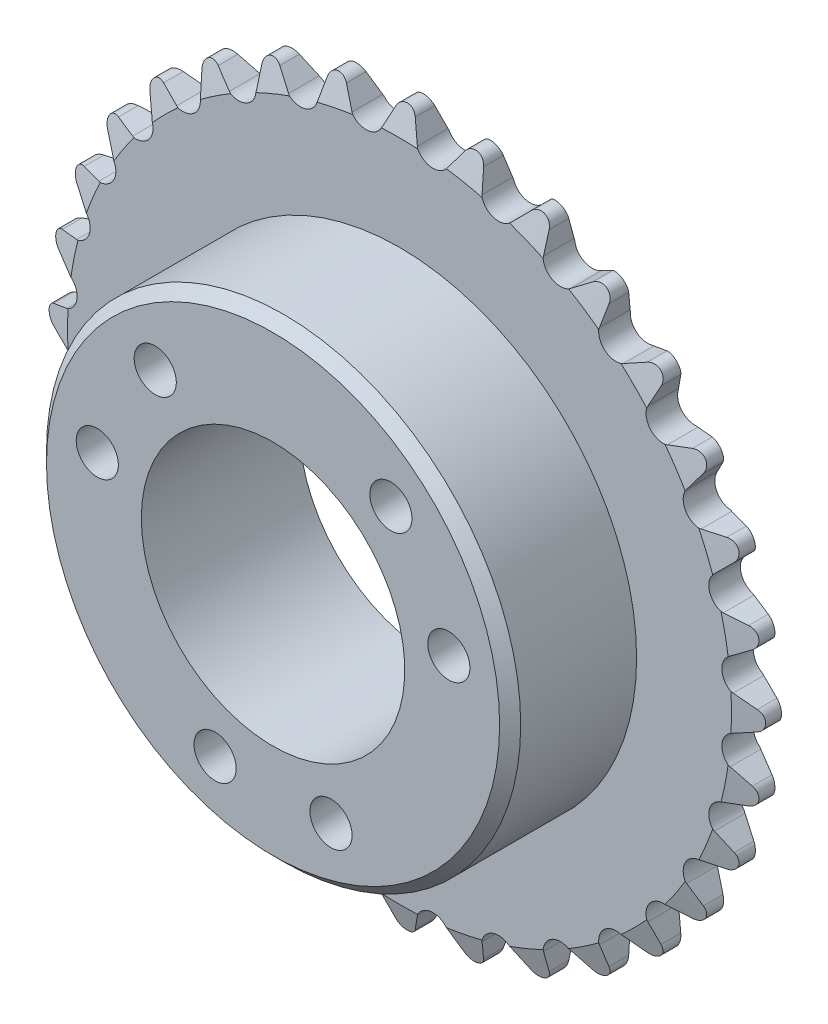
from build123d import *

# Parameters (mm, degrees)
BOSS_EXTRUDE1_DEPTH = 3
SKETCH3_R           = 22.5
BOSS_EXTRUDE2_DEPTH = 15
SKETCH4_R           = 12.5
CUT_EXTRUDE1_DEPTH  = 15
SKETCH5_R           = 2
CUT_EXTRUDE2_DEPTH  = 15


with BuildPart() as part:
    # Sketch1 → Boss-Extrude1 (new body)
    with BuildSketch(Plane.XY):
        with BuildLine():
            Line((0.925654891, 33.378368897), (1.647669429, 31.612007301))
            ThreePointArc((1.647669429, 31.612007301), (2.18900723, 30.913320041), (3.013271718, 30.594261182))
            ThreePointArc((3.013271718, 30.594261182), (3.883943491, 30.74638339), (4.551186761, 31.326035804))
            Line((4.551186761, 31.326035804), (5.603928044, 32.917599209))
            ThreePointArc((5.603928044, 32.917599209), (6.633070949, 33.346699534), (7.419665429, 32.556426587))
            Line((7.419665429, 32.556426587), (7.783206607, 30.683147085))
            ThreePointArc((7.783206607, 30.683147085), (8.177835631, 29.892275139), (8.924016813, 29.418540882))
            ThreePointArc((8.924016813, 29.418540882), (9.807636442, 29.397880468), (10.575143396, 29.836222319))
            Line((10.575143396, 29.836222319), (11.918155168, 31.191824644))
            ThreePointArc((11.918155168, 31.191824644), (13.0112367, 31.411904105), (13.628542384, 30.483359062))
            Line((13.628542384, 30.483359062), (13.61963952, 28.575150734))
            ThreePointArc((13.61963952, 28.575150734), (13.852394395, 27.722486867), (14.491816946, 27.112282554))
            ThreePointArc((14.491816946, 27.112282554), (15.354427425, 26.919633486), (16.192703201, 27.199819543))
            Line((16.192703201, 27.199819543), (17.774374272, 28.26736575))
            ThreePointArc((17.774374272, 28.26736575), (18.889387923, 28.269966818), (19.313682099, 27.238833142))
            Line((19.313682099, 27.238833142), (18.932677324, 25.369027366))
            ThreePointArc((18.932677324, 25.369027366), (18.994613411, 24.487338972), (19.502704681, 23.764114413))
            ThreePointArc((19.502704681, 23.764114413), (20.311156373, 23.406880086), (21.187986503, 23.518142956))
            Line((21.187986503, 23.518142956), (22.947534141, 24.256607843))
            ThreePointArc((22.947534141, 24.256607843), (24.04163056, 24.04163056), (24.256607843, 22.947534141))
            Line((24.256607843, 22.947534141), (23.518142956, 21.187986503))
            ThreePointArc((23.518142956, 21.187986503), (23.406880086, 20.311156373), (23.764114413, 19.502704681))
            ThreePointArc((23.764114413, 19.502704681), (24.487338972, 18.994613411), (25.369027366, 18.932677324))
            Line((25.369027366, 18.932677324), (27.238833142, 19.3136821))
            ThreePointArc((27.238833142, 19.3136821), (28.269966818, 18.889387923), (28.26736575, 17.774374272))
            Line((28.26736575, 17.774374272), (27.199819543, 16.192703201))
            ThreePointArc((27.199819543, 16.192703201), (26.919633486, 15.354427425), (27.112282554, 14.491816946))
            ThreePointArc((27.112282554, 14.491816946), (27.722486867, 13.852394395), (28.575150734, 13.61963952))
            Line((28.575150734, 13.61963952), (30.483359061, 13.628542385))
            ThreePointArc((30.483359061, 13.628542385), (31.411904105, 13.0112367), (31.191824643, 11.918155168))
            Line((31.191824643, 11.918155168), (29.836222319, 10.575143396))
            ThreePointArc((29.836222319, 10.575143396), (29.397880468, 9.807636443), (29.418540882, 8.924016813))
            ThreePointArc((29.418540882, 8.924016813), (29.892275139, 8.177835631), (30.683147085, 7.783206607))
            Line((30.683147085, 7.783206607), (32.556426587, 7.419665429))
            ThreePointArc((32.556426587, 7.419665429), (33.346699534, 6.633070949), (32.917599209, 5.603928044))
            Line((32.917599209, 5.603928044), (31.326035804, 4.551186761))
            ThreePointArc((31.326035804, 4.551186761), (30.74638339, 3.883943491), (30.594261182, 3.013271719))
            ThreePointArc((30.594261182, 3.013271719), (30.91332004, 2.18900723), (31.612007301, 1.647669429))
            Line((31.612007301, 1.647669429), (33.378368897, 0.925654891))
            ThreePointArc((33.378368897, 0.925654891), (34, 0), (33.378368897, -0.925654891))
            Line((33.378368897, -0.925654891), (31.612007301, -1.647669429))
            ThreePointArc((31.612007301, -1.647669429), (30.913320041, -2.18900723), (30.594261182, -3.013271718))
            ThreePointArc((30.594261182, -3.013271718), (30.74638339, -3.883943491), (31.326035804, -4.551186761))
            Line((31.326035804, -4.551186761), (32.917599209, -5.603928044))
            ThreePointArc((32.917599209, -5.603928044), (33.346699534, -6.633070948), (32.556426587, -7.419665429))
            Line((32.556426587, -7.419665429), (30.683147085, -7.783206607))
            ThreePointArc((30.683147085, -7.783206607), (29.892275139, -8.177835631), (29.418540882, -8.924016813))
            ThreePointArc((29.418540882, -8.924016813), (29.397880468, -9.807636442), (29.836222319, -10.575143396))
            Line((29.836222319, -10.575143396), (31.191824643, -11.918155168))
            ThreePointArc((31.191824643, -11.918155168), (31.411904105, -13.0112367), (30.483359061, -13.628542384))
            Line((30.483359061, -13.628542384), (28.575150734, -13.61963952))
            ThreePointArc((28.575150734, -13.61963952), (27.722486867, -13.852394395), (27.112282554, -14.491816946))
            ThreePointArc((27.112282554, -14.491816946), (26.919633486, -15.354427425), (27.199819543, -16.192703201))
            Line((27.199819543, -16.192703201), (28.26736575, -17.774374272))
            ThreePointArc((28.26736575, -17.774374272), (28.269966818, -18.889387923), (27.238833142, -19.313682099))
            Line((27.238833142, -19.313682099), (25.369027366, -18.932677324))
            ThreePointArc((25.369027366, -18.932677324), (24.487338972, -18.994613411), (23.764114413, -19.502704681))
            ThreePointArc((23.764114413, -19.502704681), (23.406880086, -20.311156373), (23.518142956, -21.187986503))
            Line((23.518142956, -21.187986503), (24.256607843, -22.947534141))
            ThreePointArc((24.256607843, -22.947534141), (24.04163056, -24.04163056), (22.947534141, -24.256607843))
            Line((22.947534141, -24.256607843), (21.187986503, -23.518142956))
            ThreePointArc((21.187986503, -23.518142956), (20.311156373, -23.406880086), (19.502704681, -23.764114413))
            ThreePointArc((19.502704681, -23.764114413), (18.994613411, -24.487338972), (18.932677324, -25.369027366))
            Line((18.932677324, -25.369027366), (19.313682099, -27.238833142))
            ThreePointArc((19.313682099, -27.238833142), (18.889387923, -28.269966818), (17.774374272, -28.26736575))
            Line((17.774374272, -28.26736575), (16.192703201, -27.199819543))
            ThreePointArc((16.192703201, -27.199819543), (15.354427425, -26.919633486), (14.491816946, -27.112282554))
            ThreePointArc((14.491816946, -27.112282554), (13.852394395, -27.722486867), (13.61963952, -28.575150734))
            Line((13.61963952, -28.575150734), (13.628542384, -30.483359061))
            ThreePointArc((13.628542384, -30.483359061), (13.0112367, -31.411904105), (11.918155168, -31.191824643))
            Line((11.918155168, -31.191824643), (10.575143396, -29.836222319))
            ThreePointArc((10.575143396, -29.836222319), (9.807636443, -29.397880468), (8.924016813, -29.418540882))
            ThreePointArc((8.924016813, -29.418540882), (8.177835631, -29.892275139), (7.783206607, -30.683147085))
            Line((7.783206607, -30.683147085), (7.419665429, -32.556426587))
            ThreePointArc((7.419665429, -32.556426587), (6.633070949, -33.346699534), (5.603928044, -32.917599209))
            Line((5.603928044, -32.917599209), (4.551186761, -31.326035804))
            ThreePointArc((4.551186761, -31.326035804), (3.883943491, -30.746383389), (3.013271718, -30.594261182))
            ThreePointArc((3.013271718, -30.594261182), (2.18900723, -30.91332004), (1.647669429, -31.612007301))
            Line((1.647669429, -31.612007301), (0.925654891, -33.378368897))
            ThreePointArc((0.925654891, -33.378368897), (0, -34), (-0.925654891, -33.378368897))
            Line((-0.925654891, -33.378368897), (-1.647669429, -31.612007301))
            ThreePointArc((-1.647669429, -31.612007301), (-2.18900723, -30.91332004), (-3.013271718, -30.594261182))
            ThreePointArc((-3.013271718, -30.594261182), (-3.883943491, -30.746383389), (-4.551186761, -31.326035804))
            Line((-4.551186761, -31.326035804), (-5.603928044, -32.917599209))
            ThreePointArc((-5.603928044, -32.917599209), (-6.633070949, -33.346699534), (-7.419665429, -32.556426587))
            Line((-7.419665429, -32.556426587), (-7.783206607, -30.683147085))
            ThreePointArc((-7.783206607, -30.683147085), (-8.177835631, -29.892275139), (-8.924016813, -29.418540882))
            ThreePointArc((-8.924016813, -29.418540882), (-9.807636442, -29.397880468), (-10.575143396, -29.836222319))
            Line((-10.575143396, -29.836222319), (-11.918155168, -31.191824643))
            ThreePointArc((-11.918155168, -31.191824643), (-13.0112367, -31.411904105), (-13.628542384, -30.483359061))
            Line((-13.628542384, -30.483359061), (-13.61963952, -28.575150734))
            ThreePointArc((-13.61963952, -28.575150734), (-13.852394395, -27.722486867), (-14.491816946, -27.112282554))
            ThreePointArc((-14.491816946, -27.112282554), (-15.354427425, -26.919633486), (-16.192703201, -27.199819543))
            Line((-16.192703201, -27.199819543), (-17.774374272, -28.26736575))
            ThreePointArc((-17.774374272, -28.26736575), (-18.889387923, -28.269966818), (-19.313682099, -27.238833142))
            Line((-19.313682099, -27.238833142), (-18.932677324, -25.369027366))
            ThreePointArc((-18.932677324, -25.369027366), (-18.994613411, -24.487338972), (-19.502704681, -23.764114413))
            ThreePointArc((-19.502704681, -23.764114413), (-20.311156373, -23.406880086), (-21.187986503, -23.518142956))
            Line((-21.187986503, -23.518142956), (-22.947534141, -24.256607843))
            ThreePointArc((-22.947534141, -24.256607843), (-24.04163056, -24.04163056), (-24.256607843, -22.947534141))
            Line((-24.256607843, -22.947534141), (-23.518142956, -21.187986503))
            ThreePointArc((-23.518142956, -21.187986503), (-23.406880086, -20.311156373), (-23.764114413, -19.502704681))
            ThreePointArc((-23.764114413, -19.502704681), (-24.487338972, -18.994613411), (-25.369027366, -18.932677324))
            Line((-25.369027366, -18.932677324), (-27.238833142, -19.313682099))
            ThreePointArc((-27.238833142, -19.313682099), (-28.269966818, -18.889387923), (-28.26736575, -17.774374272))
            Line((-28.26736575, -17.774374272), (-27.199819543, -16.192703201))
            ThreePointArc((-27.199819543, -16.192703201), (-26.919633486, -15.354427425), (-27.112282554, -14.491816946))
            ThreePointArc((-27.112282554, -14.491816946), (-27.722486867, -13.852394395), (-28.575150734, -13.61963952))
            Line((-28.575150734, -13.61963952), (-30.483359061, -13.628542384))
            ThreePointArc((-30.483359061, -13.628542384), (-31.411904105, -13.0112367), (-31.191824643, -11.918155168))
            Line((-31.191824643, -11.918155168), (-29.836222319, -10.575143396))
            ThreePointArc((-29.836222319, -10.575143396), (-29.397880468, -9.807636442), (-29.418540882, -8.924016813))
            ThreePointArc((-29.418540882, -8.924016813), (-29.892275139, -8.177835631), (-30.683147085, -7.783206607))
            Line((-30.683147085, -7.783206607), (-32.556426587, -7.419665429))
            ThreePointArc((-32.556426587, -7.419665429), (-33.346699534, -6.633070948), (-32.917599209, -5.603928044))
            Line((-32.917599209, -5.603928044), (-31.326035804, -4.551186761))
            ThreePointArc((-31.326035804, -4.551186761), (-30.74638339, -3.883943491), (-30.594261182, -3.013271718))
            ThreePointArc((-30.594261182, -3.013271718), (-30.91332004, -2.18900723), (-31.612007301, -1.647669429))
            Line((-31.612007301, -1.647669429), (-33.378368897, -0.925654891))
            ThreePointArc((-33.378368897, -0.925654891), (-34, 0), (-33.378368897, 0.925654891))
            Line((-33.378368897, 0.925654891), (-31.612007301, 1.647669429))
            ThreePointArc((-31.612007301, 1.647669429), (-30.913320041, 2.18900723), (-30.594261182, 3.013271719))
            ThreePointArc((-30.594261182, 3.013271719), (-30.74638339, 3.883943491), (-31.326035804, 4.551186761))
            Line((-31.326035804, 4.551186761), (-32.917599209, 5.603928044))
            ThreePointArc((-32.917599209, 5.603928044), (-33.346699534, 6.633070949), (-32.556426587, 7.419665429))
            Line((-32.556426587, 7.419665429), (-30.683147085, 7.783206607))
            ThreePointArc((-30.683147085, 7.783206607), (-29.892275139, 8.177835631), (-29.418540882, 8.924016813))
            ThreePointArc((-29.418540882, 8.924016813), (-29.397880468, 9.807636443), (-29.836222319, 10.575143396))
            Line((-29.836222319, 10.575143396), (-31.191824643, 11.918155168))
            ThreePointArc((-31.191824643, 11.918155168), (-31.411904105, 13.0112367), (-30.483359061, 13.628542385))
            Line((-30.483359061, 13.628542385), (-28.575150734, 13.61963952))
            ThreePointArc((-28.575150734, 13.61963952), (-27.722486867, 13.852394395), (-27.112282554, 14.491816946))
            ThreePointArc((-27.112282554, 14.491816946), (-26.919633486, 15.354427425), (-27.199819543, 16.192703201))
            Line((-27.199819543, 16.192703201), (-28.26736575, 17.774374272))
            ThreePointArc((-28.26736575, 17.774374272), (-28.269966818, 18.889387923), (-27.238833142, 19.3136821))
            Line((-27.238833142, 19.3136821), (-25.369027366, 18.932677324))
            ThreePointArc((-25.369027366, 18.932677324), (-24.487338972, 18.994613411), (-23.764114413, 19.502704681))
            ThreePointArc((-23.764114413, 19.502704681), (-23.406880086, 20.311156373), (-23.518142956, 21.187986503))
            Line((-23.518142956, 21.187986503), (-24.256607843, 22.947534141))
            ThreePointArc((-24.256607843, 22.947534141), (-24.04163056, 24.04163056), (-22.947534141, 24.256607843))
            Line((-22.947534141, 24.256607843), (-21.187986503, 23.518142956))
            ThreePointArc((-21.187986503, 23.518142956), (-20.311156373, 23.406880086), (-19.502704681, 23.764114413))
            ThreePointArc((-19.502704681, 23.764114413), (-18.994613411, 24.487338972), (-18.932677324, 25.369027366))
            Line((-18.932677324, 25.369027366), (-19.313682099, 27.238833142))
            ThreePointArc((-19.313682099, 27.238833142), (-18.889387923, 28.269966818), (-17.774374272, 28.26736575))
            Line((-17.774374272, 28.26736575), (-16.192703201, 27.199819543))
            ThreePointArc((-16.192703201, 27.199819543), (-15.354427425, 26.919633486), (-14.491816946, 27.112282554))
            ThreePointArc((-14.491816946, 27.112282554), (-13.852394395, 27.722486867), (-13.61963952, 28.575150734))
            Line((-13.61963952, 28.575150734), (-13.628542384, 30.483359062))
            ThreePointArc((-13.628542384, 30.483359062), (-13.0112367, 31.411904105), (-11.918155168, 31.191824644))
            Line((-11.918155168, 31.191824644), (-10.575143396, 29.836222319))
            ThreePointArc((-10.575143396, 29.836222319), (-9.807636443, 29.397880468), (-8.924016813, 29.418540882))
            ThreePointArc((-8.924016813, 29.418540882), (-8.177835631, 29.892275139), (-7.783206607, 30.683147085))
            Line((-7.783206607, 30.683147085), (-7.419665429, 32.556426587))
            ThreePointArc((-7.419665429, 32.556426587), (-6.633070949, 33.346699534), (-5.603928044, 32.917599209))
            Line((-5.603928044, 32.917599209), (-4.551186761, 31.326035804))
            ThreePointArc((-4.551186761, 31.326035804), (-3.883943491, 30.74638339), (-3.013271718, 30.594261182))
            ThreePointArc((-3.013271718, 30.594261182), (-2.18900723, 30.913320041), (-1.647669429, 31.612007301))
            Line((-1.647669429, 31.612007301), (-0.925654891, 33.378368897))
            ThreePointArc((-0.925654891, 33.378368897), (0, 34), (0.925654891, 33.378368897))
        make_face()
    extrude(amount=BOSS_EXTRUDE1_DEPTH)

    # Sketch3 → Boss-Extrude2 (add)
    with BuildSketch(Plane(origin=(0, 0, 0), x_dir=(-1, 0, 0), z_dir=(0, 0, -1))):
        Circle(SKETCH3_R)
    extrude(amount=-BOSS_EXTRUDE2_DEPTH)

    # Chamfer1: read off the stored shape, not the designer's step
    # Chamfer1 outline → Chamfer1 (revolve, cut)
    with BuildSketch(Plane.XZ):
        Polygon((22.5, 15), (21.5, 15), (22.5, 14), align=None)
    revolve(axis=Axis((0, 0, 0), (0, 0, 1)), mode=Mode.SUBTRACT)

    # Sketch4 → Cut-Extrude1 (cut)
    with BuildSketch(Plane(origin=(0, 0, 0), x_dir=(-1, 0, 0), z_dir=(0, 0, -1))):
        Circle(SKETCH4_R)
    extrude(amount=-CUT_EXTRUDE1_DEPTH, mode=Mode.SUBTRACT)

    # Sketch5 → Cut-Extrude2 (cut)
    with BuildSketch(Plane(origin=(0, 0, 0), x_dir=(-1, 0, 0), z_dir=(0, 0, -1))):
        with Locations((5.5, -16.085707942)):
            Circle(SKETCH5_R)
        with Locations((-5.5, -16.085707942)):
            Circle(SKETCH5_R)
        with Locations((16.680631716, 3.27971425)):
            Circle(SKETCH5_R)
        with Locations((-16.680631716, 3.27971425)):
            Circle(SKETCH5_R)
        with Locations((11.180631716, 12.805993692)):
            Circle(SKETCH5_R)
        with Locations((-11.180631716, 12.805993692)):
            Circle(SKETCH5_R)
    extrude(amount=-CUT_EXTRUDE2_DEPTH, mode=Mode.SUBTRACT)

    # Sketch6 → Cut-Revolve2 (revolve, cut)
    with BuildSketch(Plane(origin=(0, 0, 0), x_dir=(1, 0, 0), z_dir=(0, 1, 0)), mode=Mode.PRIVATE) as cut_revolve2_sk:
        Polygon((34, -3), (34, -2.25), (31.5, -3), align=None)
        Polygon((34, 0), (34, -0.75), (31.5, 0), align=None)
    revolve(cut_revolve2_sk.sketch.rotate(Axis((0, 0, 0), (0, 0, 1)), 180), axis=Axis((0, 0, 0), (0, 0, 1)), mode=Mode.SUBTRACT)


solid = part.part
